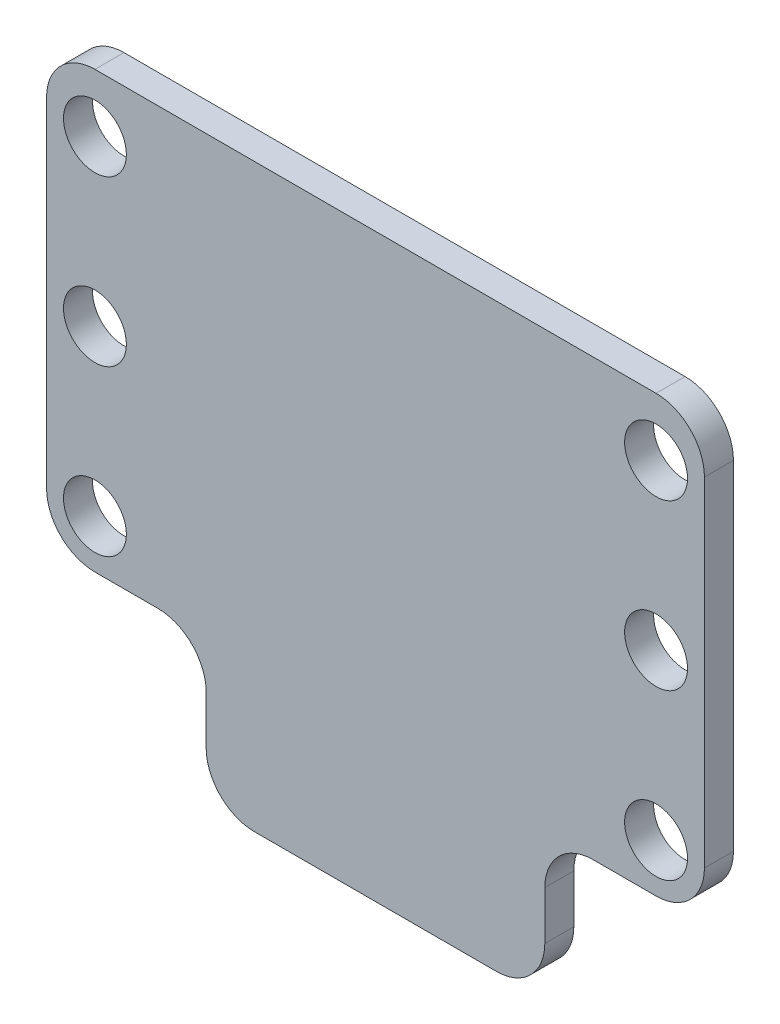
from build123d import *

# Parameters (mm, degrees)
ESQUISSE2_R        = 3.25
BOSS_EXTRU_1_DEPTH = 3
CONG_1_R           = 5


with BuildPart() as part:
    # Esquisse2 → Boss.-Extru.1 (new body)
    with BuildSketch(Plane.XY):
        Polygon((107.208492459, -4.098526588), (39.208492459, -4.098526588), (39.208492459, -49.098526588), (55.708492459, -49.098526588), (55.708492459, -64.098526588), (90.708492459, -64.098526588), (90.708492459, -49.098526588), (107.208492459, -49.098526588), align=None)
        with Locations((102.208492459, -10.098526588)):
            Circle(ESQUISSE2_R, mode=Mode.SUBTRACT)
        with Locations((102.208492459, -44.098526588)):
            Circle(ESQUISSE2_R, mode=Mode.SUBTRACT)
        with Locations((44.208492459, -44.098526588)):
            Circle(ESQUISSE2_R, mode=Mode.SUBTRACT)
        with Locations((44.208492459, -10.098526588)):
            Circle(ESQUISSE2_R, mode=Mode.SUBTRACT)
        with Locations((44.208492459, -27.098526588)):
            Circle(ESQUISSE2_R, mode=Mode.SUBTRACT)
        with Locations((102.208492459, -27.098526588)):
            Circle(ESQUISSE2_R, mode=Mode.SUBTRACT)
    extrude(amount=BOSS_EXTRU_1_DEPTH)

    # Congé1
    cong_1_edges = [part.edges().sort_by_distance(p)[0] for p in [
        (39.208492459, -4.098526588, 1.5),
        (39.208492459, -49.098526588, 1.5),
        (55.708492459, -64.098526588, 1.5),
        (55.708492459, -49.098526588, 1.5),
        (90.708492459, -64.098526588, 1.5),
        (90.708492459, -49.098526588, 1.5),
        (107.208492459, -49.098526588, 1.5),
        (107.208492459, -4.098526588, 1.5),
    ]]
    fillet(cong_1_edges, radius=CONG_1_R)


solid = part.part
